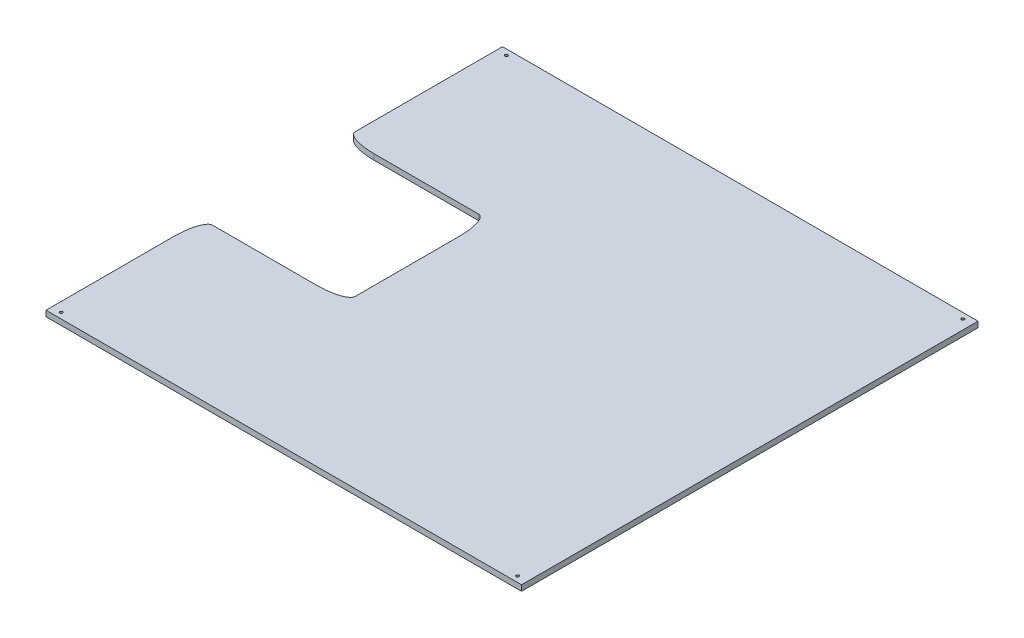
from build123d import *

# Parameters (mm, degrees)
SKETCH1_R           = 1.525
SKETCH1_R_2         = 1.5
BOSS_EXTRUDE1_DEPTH = 6
FILLET1_SIZE        = 10
FILLET1_SIZE_2      = 30


with BuildPart() as part:
    # Sketch1 → Boss-Extrude1 (new body)
    with BuildSketch(Plane(origin=(0, 0, 0), x_dir=(1, 0, 0), z_dir=(0, 1, 0))):
        Polygon((500, 0), (0, 0), (0, -165), (150, -165), (150, -315), (0, -315), (0, -480), (500, -480), align=None)
        with Locations(Location((10, -474, 0), (0, 0, 270))):
            Circle(SKETCH1_R, mode=Mode.SUBTRACT)
        with Locations(Location((490, -474, 0), (0, 0, 270))):
            Circle(SKETCH1_R_2, mode=Mode.SUBTRACT)
        with Locations(Location((10, -6, 0), (0, 0, 270))):
            Circle(SKETCH1_R_2, mode=Mode.SUBTRACT)
        with Locations(Location((490, -6, 0), (0, 0, 270))):
            Circle(SKETCH1_R_2, mode=Mode.SUBTRACT)
    extrude(amount=BOSS_EXTRUDE1_DEPTH)

    # Fillet1
    # an asymmetric fillet: 30, 10 mm, written as the material it adds along each edge
    with BuildSketch(Plane(origin=(150, 0, 315), x_dir=(0, 0, -1), z_dir=(0, 1, 0)), Plane(origin=(150, 0, 165), x_dir=(-1, 0, 0), z_dir=(0, 1, 0))) as fillet1_piece_1:
        with BuildLine():
            Bezier((FILLET1_SIZE, 0), (0, 0), (0, FILLET1_SIZE_2), weights=[1, 0.707106781, 1])
            Line((0, FILLET1_SIZE_2), (0, 0))
            Line((0, 0), (FILLET1_SIZE, 0))
        make_face()
    extrude(amount=6)
    # an asymmetric fillet: 30, 10 mm, written as the material it takes off along each edge
    with BuildSketch(Plane(origin=(0, -75, 165), x_dir=(0, 0, -1), z_dir=(0, 1, 0)), Plane(origin=(0, -75, 315), x_dir=(1, 0, 0), z_dir=(0, 1, 0))) as fillet1_2_piece_1:
        with BuildLine():
            Bezier((FILLET1_SIZE, 0), (0, 0), (0, -FILLET1_SIZE_2), weights=[1, 0.707106781, 1])
            Line((0, -FILLET1_SIZE_2), (0, 0))
            Line((0, 0), (FILLET1_SIZE, 0))
        make_face()
    extrude(amount=156, mode=Mode.SUBTRACT)


solid = part.part
